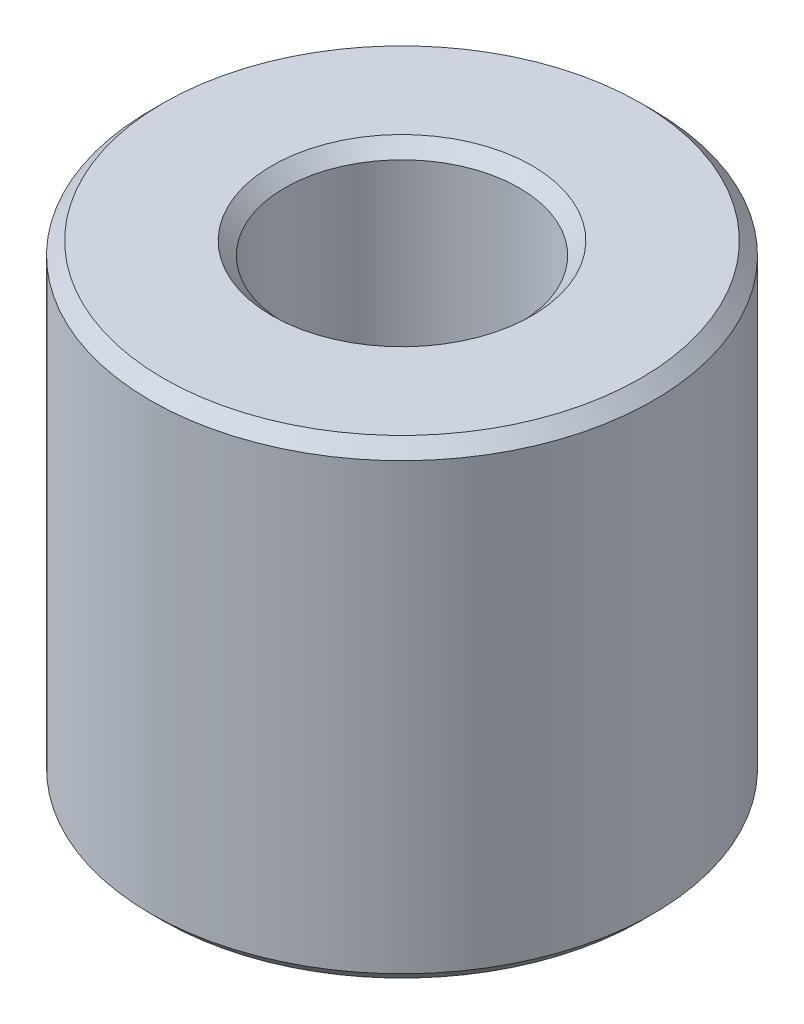
from build123d import *

# Parameters (mm, degrees)
SKETCH1_R           = 55
BOSS_EXTRUDE1_DEPTH = 102.823793376
SKETCH2_R           = 25.638615634
CUT_EXTRUDE1_DEPTH  = 129.929176233
CHAMFER1_SIZE       = 2.804941731


with BuildPart() as part:
    # Sketch1 → Boss-Extrude1 (new body)
    with BuildSketch(Plane(origin=(0, 0, 0), x_dir=(1, 0, 0), z_dir=(0, 1, 0))):
        Circle(SKETCH1_R)
    extrude(amount=BOSS_EXTRUDE1_DEPTH)

    # Sketch2 → Cut-Extrude1 (cut, through all)
    with BuildSketch(Plane(origin=(0, 0, 0), x_dir=(1, 0, 0), z_dir=(0, 1, 0))):
        Circle(SKETCH2_R)
    extrude(amount=CUT_EXTRUDE1_DEPTH, mode=Mode.SUBTRACT)

    # Chamfer1
    chamfer1_edges = [part.edges().sort_by_distance(p)[0] for p in [
        (-25.638615634, 102.823793376, 0),
        (-25.638615634, 0, 0),
        (-55, 0, 0),
        (-55, 102.823793376, 0),
    ]]
    chamfer(chamfer1_edges, length=CHAMFER1_SIZE)


solid = part.part
